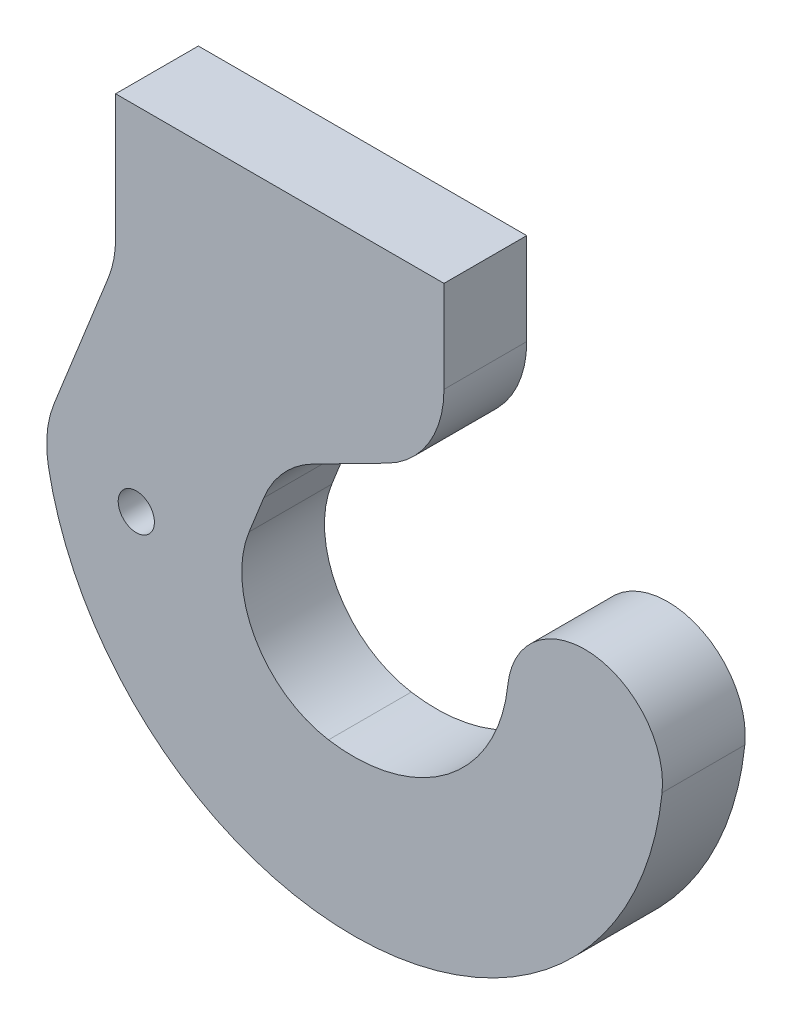
from build123d import *

# Parameters (mm, degrees)
BOSS_EXTRUDE1_DEPTH     = 4
FILLET1_R               = 10
CUT_EXTRUDE1_DEPTH      = 44.090056372
CUT_EXTRUDE1_DEPTH_BACK = 44.090056372
SKETCH3_R               = 1.75


with BuildPart() as part:
    # Sketch2 → Boss-Extrude1 (new, symmetric)
    with BuildSketch(Plane(origin=(0, 0, 5), x_dir=(-1, 0, 0), z_dir=(0, 0, -1))):
        with BuildLine():
            Line((-8.75, 29), (23, 29))
            Line((23, 29), (23, 15))
            Line((23, 15), (29.90933601, -2.330583498))
            ThreePointArc((29.90933601, -2.330583498), (0.390036132, -29.997464423), (-29.838629118, -3.107444664))
            ThreePointArc((-29.838629118, -3.107444664), (-23.155833005, 5.129073782), (-14.919314559, -1.553722332))
            ThreePointArc((-14.919314559, -1.553722332), (-3.352723212, -14.620507757), (12.751621302, -7.899123633))
            Line((12.751621302, -7.899123633), (7.282910832, 5.817960508))
            Line((7.282910832, 5.817960508), (-8.75, 14))
            Line((-8.75, 14), (-8.75, 29))
        make_face()
    extrude(amount=BOSS_EXTRUDE1_DEPTH, both=True)

    # Fillet1
    fillet1_edges = [part.edges().sort_by_distance(p)[0] for p in [
        (-23, 15, 5),
        (-29.90933601, -2.330583498, 5),
        (8.75, 14, 5),
        (-7.282910832, 5.817960508, 5),
        (-12.751621302, -7.899123633, 5),
    ]]
    fillet(fillet1_edges, radius=FILLET1_R)

    # Sketch3 → Cut-Extrude1 (cut, two sides: drawn at the far end of the back side and taken through both)
    with BuildSketch(Plane.XY.offset(9).offset(-CUT_EXTRUDE1_DEPTH_BACK)):
        with Locations((-21, -5)):
            Circle(SKETCH3_R)
    extrude(amount=CUT_EXTRUDE1_DEPTH + CUT_EXTRUDE1_DEPTH_BACK, mode=Mode.SUBTRACT)


solid = part.part
